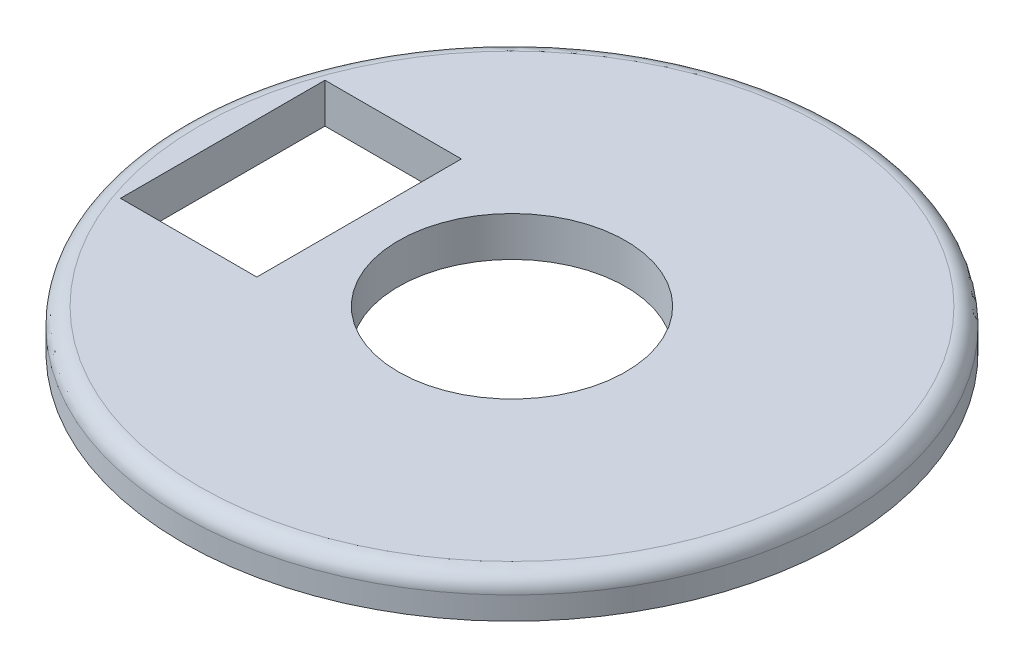
from build123d import *

# Parameters (mm, degrees)
SKETCH1_R           = 184.15
SKETCH1_R_2         = 63.5
BOSS_EXTRUDE1_DEPTH = 22.225
FILLET1_R           = 9.525
SKETCH2_W           = 76.2
SKETCH2_H           = 114.3
CUT_EXTRUDE4_DEPTH  = 262.374053153


with BuildPart() as part:
    # Sketch1 → Boss-Extrude1 (new body)
    with BuildSketch(Plane(origin=(0, 0, 0), x_dir=(1, 0, 0), z_dir=(0, 1, 0))):
        Circle(SKETCH1_R)
        Circle(SKETCH1_R_2, mode=Mode.SUBTRACT)
    extrude(amount=BOSS_EXTRUDE1_DEPTH)

    # Fillet1
    fillet1_edges = [part.edges().sort_by_distance(p)[0] for p in [
        (-184.15, 22.225, 0),
    ]]
    fillet(fillet1_edges, radius=FILLET1_R)

    # Sketch2 → Cut-Extrude4 (cut, through all)
    with BuildSketch(Plane(origin=(0, 0, 0), x_dir=(1, 0, 0), z_dir=(0, 1, 0))):
        with Locations((-123.544610179, 0)):
            Rectangle(SKETCH2_W, SKETCH2_H)
    extrude(amount=CUT_EXTRUDE4_DEPTH, mode=Mode.SUBTRACT)


solid = part.part
